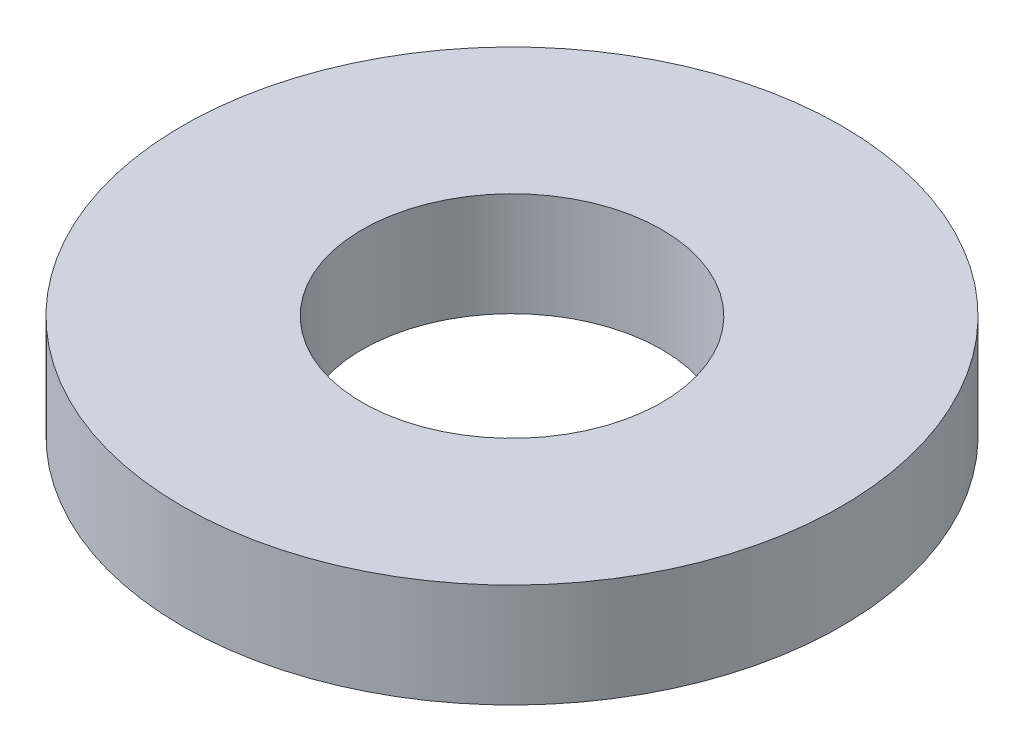
from build123d import *

# Parameters (mm, degrees)
SKETCH1_R           = 82.5
BOSS_EXTRUDE1_DEPTH = 26
SKETCH2_R           = 37.5
CUT_EXTRUDE1_DEPTH  = 120.534513844


with BuildPart() as part:
    # Sketch1 → Boss-Extrude1 (new body)
    with BuildSketch(Plane(origin=(0, 0, 0), x_dir=(1, 0, 0), z_dir=(0, 1, 0))):
        Circle(SKETCH1_R)
    extrude(amount=BOSS_EXTRUDE1_DEPTH)

    # Sketch2 → Cut-Extrude1 (cut, through all)
    with BuildSketch(Plane(origin=(0, 0, 0), x_dir=(1, 0, 0), z_dir=(0, 1, 0))):
        Circle(SKETCH2_R)
    extrude(amount=CUT_EXTRUDE1_DEPTH, mode=Mode.SUBTRACT)


solid = part.part
